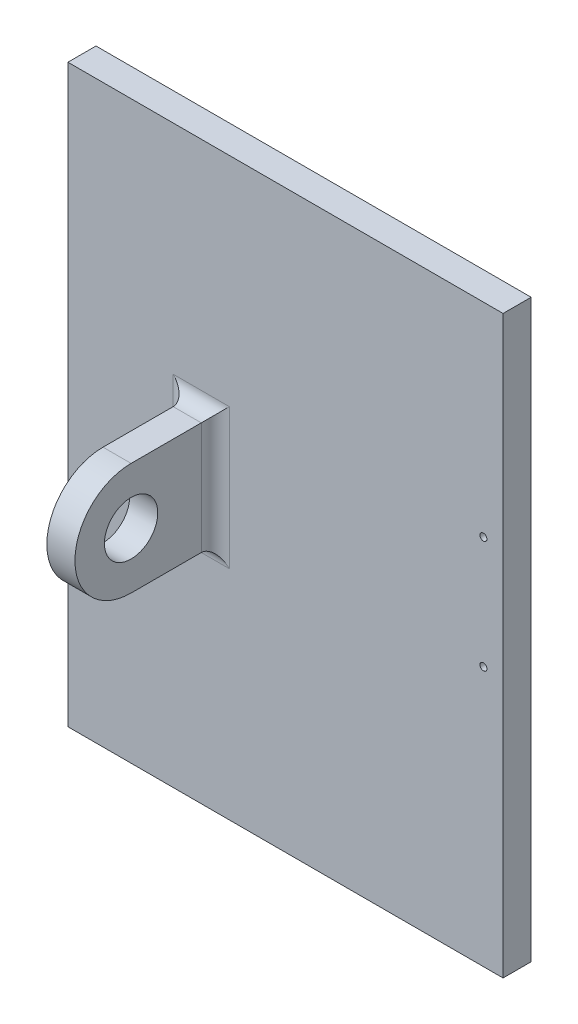
from build123d import *

# Parameters (mm, degrees)
SKETCH_2_W          = 155
SKETCH_2_H          = 205
EXTRUDE_1_DEPTH     = 10
SKETCH_3_W          = 10
SKETCH_3_H          = 40
EXTRUDE_2_DEPTH     = 40
SKETCH_4_R          = 20
EXTRUDE_3_DEPTH     = 10
SKETCH_5_R          = 9.5
CUT_EXTRUDE_1_DEPTH = 10
M3X0_5_2_D          = 2.5
FILLET_1_R          = 5


with BuildPart() as part:
    # ｽｹｯﾁ2 → ﾎﾞｽ - 押し出し1 (new body)
    with BuildSketch(Plane.XY):
        Rectangle(SKETCH_2_W, SKETCH_2_H)
    extrude(amount=EXTRUDE_1_DEPTH)

    # ｽｹｯﾁ3 → ﾎﾞｽ - 押し出し2 (add)
    with BuildSketch(Plane.XY):
        with Locations((-30, 0)):
            Rectangle(SKETCH_3_W, SKETCH_3_H)
    extrude(amount=EXTRUDE_2_DEPTH)

    # ｽｹｯﾁ4 → ﾎﾞｽ - 押し出し3 (add)
    with BuildSketch(Plane.ZY.offset(35)):
        with Locations((40, 0)):
            Circle(SKETCH_4_R)
    extrude(amount=-EXTRUDE_3_DEPTH)

    # ｽｹｯﾁ5 → ｶｯﾄ - 押し出し1 (cut)
    with BuildSketch(Plane.ZY.offset(35)):
        with Locations((40, 0)):
            Circle(SKETCH_5_R)
    extrude(amount=-CUT_EXTRUDE_1_DEPTH, mode=Mode.SUBTRACT)

    # M3x0.5 ねじ穴2 (through all)
    with Locations(Plane.XY.offset(10)):
        with Locations((70.5, -10.000898701), (70.5, 29.999101299)):
            Hole(M3X0_5_2_D / 2)

    # ﾌｨﾚｯﾄ1
    fillet_1_edges = [part.edges().sort_by_distance(p)[0] for p in [
        (-30, -20, 10),
        (-35, 0, 10),
        (-30, 20, 10),
        (-25, 0, 10),
    ]]
    fillet(fillet_1_edges, radius=FILLET_1_R)


solid = part.part
